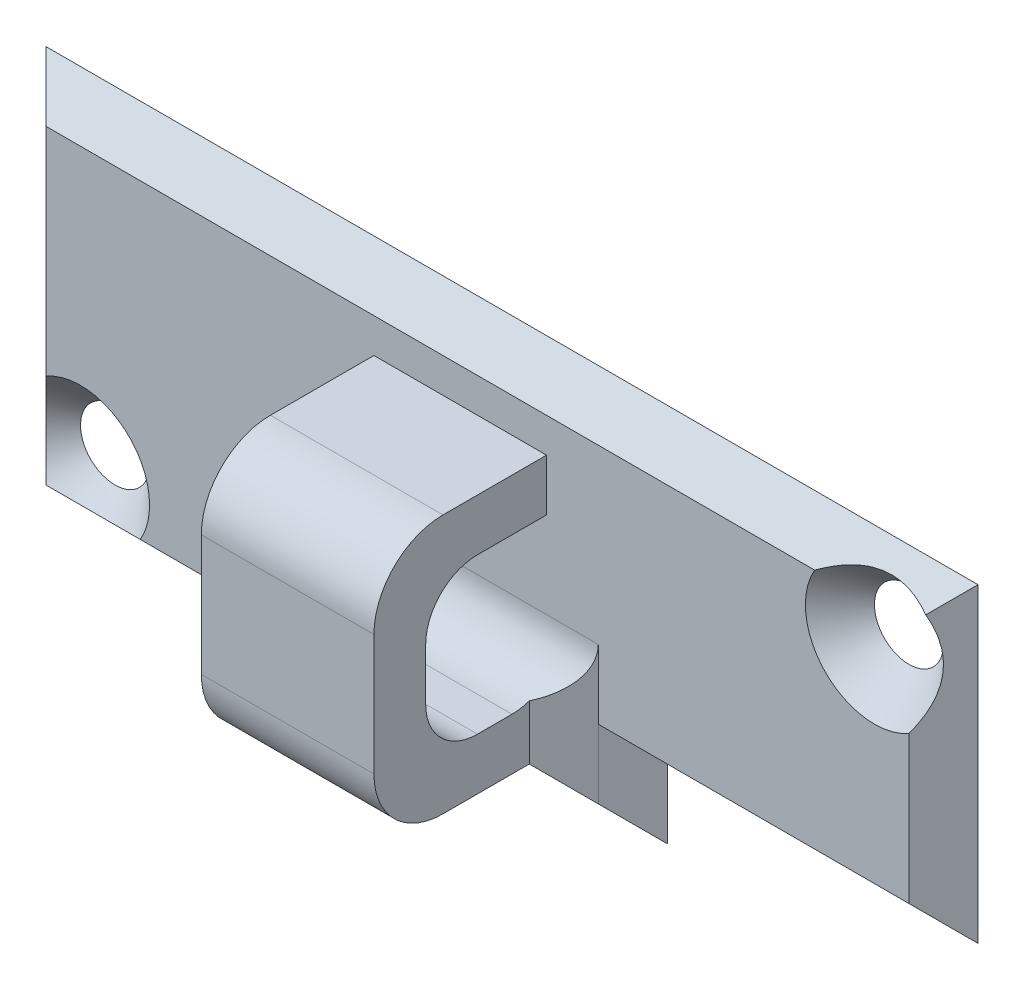
from build123d import *

# Parameters (mm, degrees)
SKETCH1_R           = 1
BOSS_EXTRUDE1_DEPTH = 1
BOSS_EXTRUDE6_DEPTH = 2.5
FILLET6_R           = 1.5
FILLET7_R           = 2
CHAMFER1_SIZE       = 1


# Some blends are built 0.0001 mm under size
with BuildPart() as part:
    # Sketch1 → Boss-Extrude1 (new body)
    with BuildSketch(Plane.XY):
        Polygon((-13.5, 5.5), (-13.5, -5.5), (4.5, -5.5), (4.5, -3.5), (13.5, -3.5), (13.5, 5.5), align=None)
        with Locations((-11.5, -3.5)):
            Circle(SKETCH1_R, mode=Mode.SUBTRACT)
        with Locations((11.5, 3.5)):
            Circle(SKETCH1_R, mode=Mode.SUBTRACT)
    extrude(amount=BOSS_EXTRUDE1_DEPTH)

    # Sketch3 → Boss-Extrude6 (add, symmetric)
    with BuildSketch(Plane(origin=(0, 0, 0), x_dir=(0, 0, -1), z_dir=(1, 0, 0))):
        Polygon((-1, -3.5), (-6.5, -3.5), (-6.5, 4), (-1.5, 4), (-1.5, 2.5), (-5, 2.5), (-5, -2), (-1, -2), align=None)
    extrude(amount=BOSS_EXTRUDE6_DEPTH, both=True)

    # Fillet6
    fillet6_edges = [part.edges().sort_by_distance(p)[0] for p in [
        (0, -2, 1),
        (0, 2.5, 5),
        (0, -2, 5),
    ]]
    fillet(fillet6_edges, radius=FILLET6_R)

    # Fillet7
    fillet7_edges = [part.edges().sort_by_distance(p)[0] for p in [
        (0, -3.5, 6.5),
        (0, 4, 6.5),
    ]]
    fillet(fillet7_edges, radius=FILLET7_R)

    # Chamfer1
    chamfer1_edges = [part.edges().sort_by_distance(p)[0] for p in [
        (0, 5.5, 1),
    ]]
    chamfer(chamfer1_edges, length=CHAMFER1_SIZE - 0.0001)  # a hair under: the kernel refuses the full size
    chamfer1_2_edges = [part.edges().sort_by_distance(p)[0] for p in [
        (-4.5, -5.5, 1),
    ]]
    chamfer(chamfer1_2_edges, length=CHAMFER1_SIZE - 0.0001)  # a hair under: the kernel refuses the full size
    chamfer1_3_edges = [part.edges().sort_by_distance(p)[0] for p in [
        (-13.5, 0, 1),
    ]]
    chamfer(chamfer1_3_edges, length=CHAMFER1_SIZE - 0.0001)  # a hair under: the kernel refuses the full size
    chamfer1_4_edges = [part.edges().sort_by_distance(p)[0] for p in [
        (9, -3.5, 1),
    ]]
    chamfer(chamfer1_4_edges, length=CHAMFER1_SIZE - 0.0001)  # a hair under: the kernel refuses the full size
    chamfer1_5_edges = [part.edges().sort_by_distance(p)[0] for p in [
        (13.5, 1, 1),
    ]]
    chamfer(chamfer1_5_edges, length=CHAMFER1_SIZE - 0.0001)  # a hair under: the kernel refuses the full size
    chamfer1_6_edges = [part.edges().sort_by_distance(p)[0] for p in [
        (0, -3.5, 1),
    ]]
    chamfer(chamfer1_6_edges, length=CHAMFER1_SIZE)
    chamfer1_7_edges = [part.edges().sort_by_distance(p)[0] for p in [
        (-2.5, -2, 1),
    ]]
    chamfer(chamfer1_7_edges, length=CHAMFER1_SIZE)
    chamfer1_8_edges = [part.edges().sort_by_distance(p)[0] for p in [
        (2.5, -2, 1),
    ]]
    chamfer(chamfer1_8_edges, length=CHAMFER1_SIZE)
    chamfer1_9_edges = [part.edges().sort_by_distance(p)[0] for p in [
        (4.5, -4.00005, 1),
    ]]
    chamfer(chamfer1_9_edges, length=CHAMFER1_SIZE - 0.0001)  # a hair under: the kernel refuses the full size
    # the kernel refuses this chamfer: 1 mm, written as the material it takes off along each edge
    with BuildSketch(Plane(origin=(11.5, 3.5, 1), x_dir=(1, 0, 0), z_dir=(0, -1, 0))) as chamfer1_10_piece_1:
        with BuildLine():
            Line((2.028284271, 0.028284271), (0.971715729, -1.028284271))
            Line((0.971715729, -1.028284271), (0.951715729, -1.028284271))
            ThreePointArc((0.951715729, -1.028284271), (0.98, -0.514142136), (0.98, 0))
            Line((0.98, 0), (1, 0.02))
            ThreePointArc((1, 0.02), (1.514142136, 0.02), (2.028284271, 0.048284271))
            Line((2.028284271, 0.048284271), (2.028284271, 0.028284271))
        make_face()
    revolve(axis=Axis((11.5, 3.5, 1), (0, 0, 1)), mode=Mode.SUBTRACT)
    # the kernel refuses this chamfer: 1 mm, written as the material it takes off along each edge
    with BuildSketch(Plane(origin=(-11.5, -3.5, 1), x_dir=(1, 0, 0), z_dir=(0, -1, 0))) as chamfer1_11_piece_1:
        with BuildLine():
            Line((2.028284271, 0.028284271), (0.971715729, -1.028284271))
            Line((0.971715729, -1.028284271), (0.951715729, -1.028284271))
            ThreePointArc((0.951715729, -1.028284271), (0.98, -0.514142136), (0.98, 0))
            Line((0.98, 0), (1, 0.02))
            ThreePointArc((1, 0.02), (1.514142136, 0.02), (2.028284271, 0.048284271))
            Line((2.028284271, 0.048284271), (2.028284271, 0.028284271))
        make_face()
    revolve(axis=Axis((-11.5, -3.5, 1), (0, 0, 1)), mode=Mode.SUBTRACT)


solid = part.part
